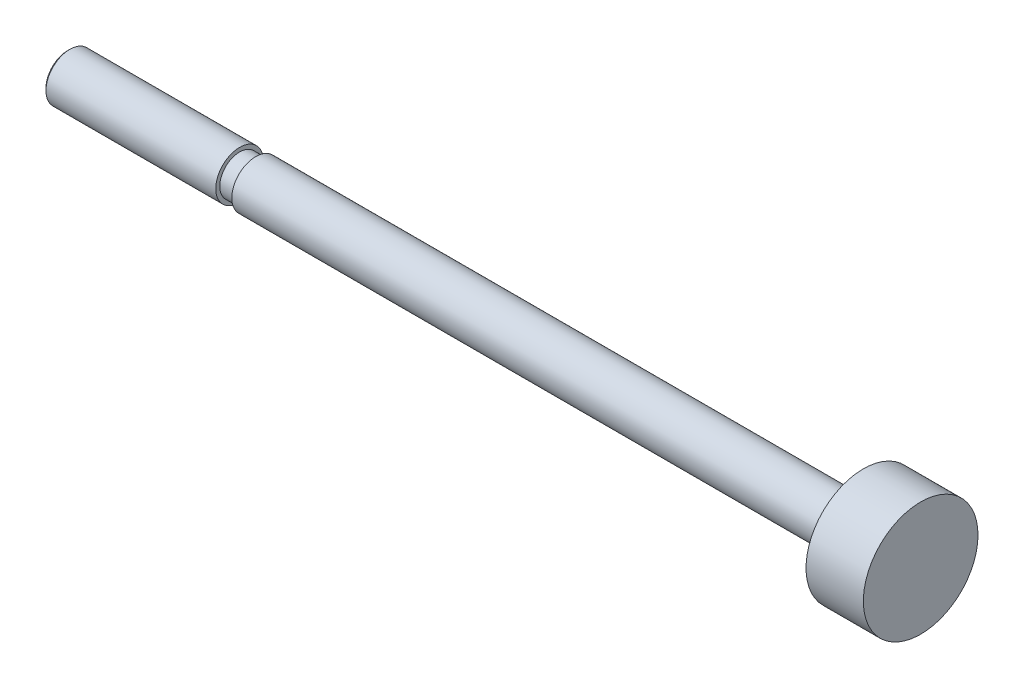
from build123d import *

# Parameters (mm, degrees)
SKETCH1_R           = 4.99999
SKETCH1_R_2         = 2.182749
SKETCH1_R_3         = 2.0828
SKETCH1_R_4         = 1.932813
SKETCH1_R_5         = 1.732788
BOSS_EXTRUDE2_DEPTH = 4.99999
SKETCH1_5_R         = 2.0828
BOSS_EXTRUDE3_DEPTH = 57.999884
BOSS_EXTRUDE4_START = -57.999884
SKETCH1_6_R         = 1.932813
BOSS_EXTRUDE4_DEPTH = 0.199898
BOSS_EXTRUDE5_START = -58.199782
SKETCH1_7_R         = 1.732788
BOSS_EXTRUDE5_DEPTH = 1.199896
BOSS_EXTRUDE6_START = -59.399678
SKETCH1_8_R         = 2.0828
BOSS_EXTRUDE6_DEPTH = 14.99997
CHAMFER1_SIZE       = 0.2032
CHAMFER2_SIZE       = 0.1905


with BuildPart() as part:
    # Sketch1 → Boss-Extrude2 (new body)
    # profile 1 of 5: a face of its own
    with BuildSketch(Plane(origin=(0, 0, 0), x_dir=(0, 0, -1), z_dir=(1, 0, 0))):
        Circle(SKETCH1_R)
        Circle(SKETCH1_R_2, mode=Mode.SUBTRACT)
    # profile 2 of 5: a face of its own
    with BuildSketch(Plane(origin=(0, 0, 0), x_dir=(0, 0, -1), z_dir=(1, 0, 0))):
        Circle(SKETCH1_R_2)
        Circle(SKETCH1_R_3, mode=Mode.SUBTRACT)
    # profile 3 of 5: a face of its own
    with BuildSketch(Plane(origin=(0, 0, 0), x_dir=(0, 0, -1), z_dir=(1, 0, 0))):
        Circle(SKETCH1_R_3)
        Circle(SKETCH1_R_4, mode=Mode.SUBTRACT)
    # profile 4 of 5: a face of its own
    with BuildSketch(Plane(origin=(0, 0, 0), x_dir=(0, 0, -1), z_dir=(1, 0, 0))):
        Circle(SKETCH1_R_4)
        Circle(SKETCH1_R_5, mode=Mode.SUBTRACT)
    # profile 5 of 5: a face of its own
    with BuildSketch(Plane(origin=(0, 0, 0), x_dir=(0, 0, -1), z_dir=(1, 0, 0))):
        Circle(SKETCH1_R_5)
    extrude(amount=-BOSS_EXTRUDE2_DEPTH)

    # Sketch1<5> → Boss-Extrude3 (add)
    with BuildSketch(Plane(origin=(0, 0, 0), x_dir=(0, 0, -1), z_dir=(1, 0, 0))):
        Circle(SKETCH1_5_R)
    extrude(amount=-BOSS_EXTRUDE3_DEPTH)

    # Sketch1<6> → Boss-Extrude4 (add)
    with BuildSketch(Plane(origin=(0, 0, 0), x_dir=(0, 0, -1), z_dir=(1, 0, 0)).offset(BOSS_EXTRUDE4_START)):
        Circle(SKETCH1_6_R)
    extrude(amount=-BOSS_EXTRUDE4_DEPTH)

    # Sketch1<7> → Boss-Extrude5 (add)
    with BuildSketch(Plane(origin=(0, 0, 0), x_dir=(0, 0, -1), z_dir=(1, 0, 0)).offset(BOSS_EXTRUDE5_START)):
        Circle(SKETCH1_7_R)
    extrude(amount=-BOSS_EXTRUDE5_DEPTH)

    # Sketch1<8> → Boss-Extrude6 (add)
    with BuildSketch(Plane(origin=(0, 0, 0), x_dir=(0, 0, -1), z_dir=(1, 0, 0)).offset(BOSS_EXTRUDE6_START)):
        Circle(SKETCH1_8_R)
    extrude(amount=-BOSS_EXTRUDE6_DEPTH)

    # Chamfer1
    # the kernel refuses this chamfer: 0.2032 mm, written as the material it takes off along each edge
    with BuildSketch(Plane(origin=(-58.199782, 0, 0), x_dir=(0, 0, -1), z_dir=(0, -1, 0))) as chamfer1_piece_1_section:
        Polygon((1.932813 - CHAMFER1_SIZE, 0), (1.932813, CHAMFER1_SIZE), (1.932813, 0), align=None)
    chamfer1_piece_1 = revolve(axis=Axis((-58.199782, 0, 0), (1, 0, 0)), mode=Mode.PRIVATE)
    chamfer1_piece_1 = chamfer1_piece_1 - Plane(origin=(-58.102785298, 0, 0), x_dir=(0, 0, -1), z_dir=(1, 0, 0)) * Cylinder(1.732788, 8, mode=Mode.PRIVATE)
    chamfer1_piece_1 = split(chamfer1_piece_1, bisect_by=Plane(origin=(-57.999884, 0, 1.835689298), z_dir=(-1, 0, 0)), keep=Keep.TOP, mode=Mode.PRIVATE)
    add(chamfer1_piece_1, mode=Mode.SUBTRACT)

    # Chamfer2
    chamfer2_edges = [part.edges().sort_by_distance(p)[0] for p in [
        (-74.399648, 0, 2.0828),
    ]]
    chamfer(chamfer2_edges, length=CHAMFER2_SIZE)


solid = part.part
